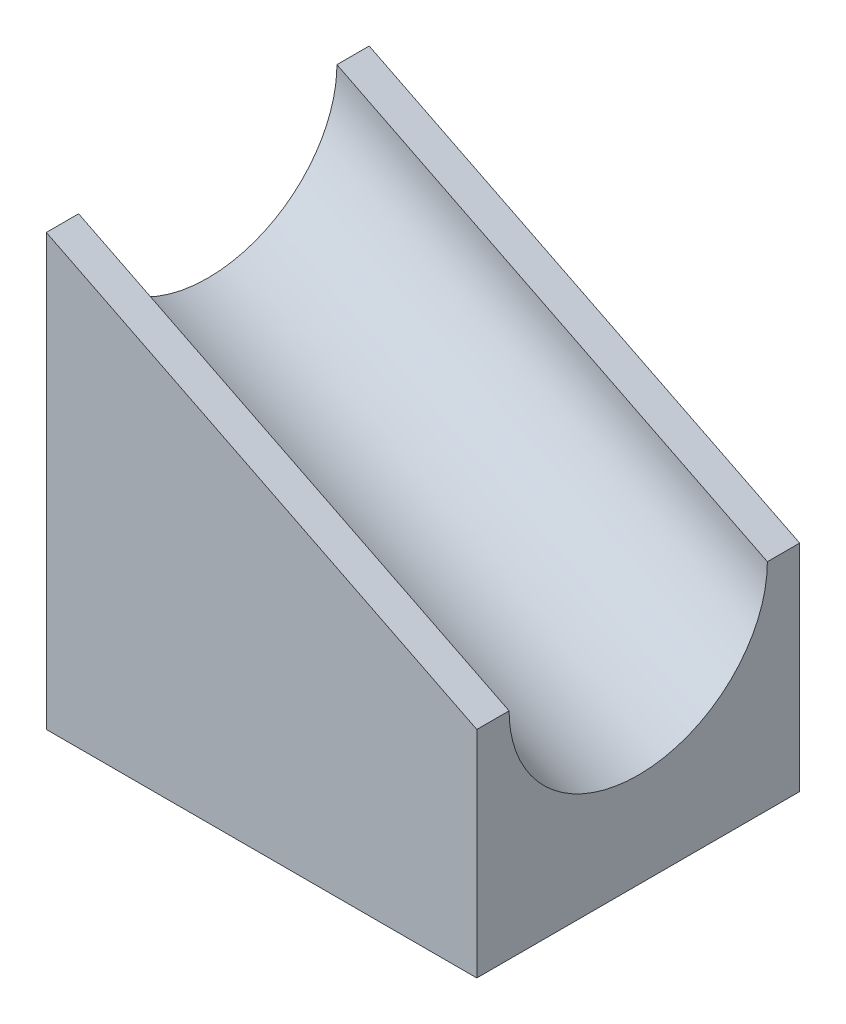
from build123d import *

# Parameters (mm, degrees)
BOSS_EXTRUDE1_DEPTH = 19.05
SKETCH3_RX          = 7.62
SKETCH3_RY          = 6.35
CUT_EXTRUDE1_DEPTH  = 40.4518504


with BuildPart() as part:
    # Sketch1 → Boss-Extrude1 (new body)
    with BuildSketch(Plane.XY):
        Polygon((-12.7, 12.7), (12.7, 0), (12.7, -12.7), (-12.7, -12.7), align=None)
    extrude(amount=BOSS_EXTRUDE1_DEPTH)

    # Sketch3 → Cut-Extrude1 (cut, through all)
    with BuildSketch(Plane(origin=(-15.24, 7.62, 0), x_dir=(0, 0, -1), z_dir=(-0.8944271909999161, 0.4472135954999578, 0))):
        with Locations(Location((-9.525, -5.679612663), (0, 0, 0))):
            Ellipse(SKETCH3_RX, SKETCH3_RY)
    extrude(amount=-CUT_EXTRUDE1_DEPTH, mode=Mode.SUBTRACT)


solid = part.part
